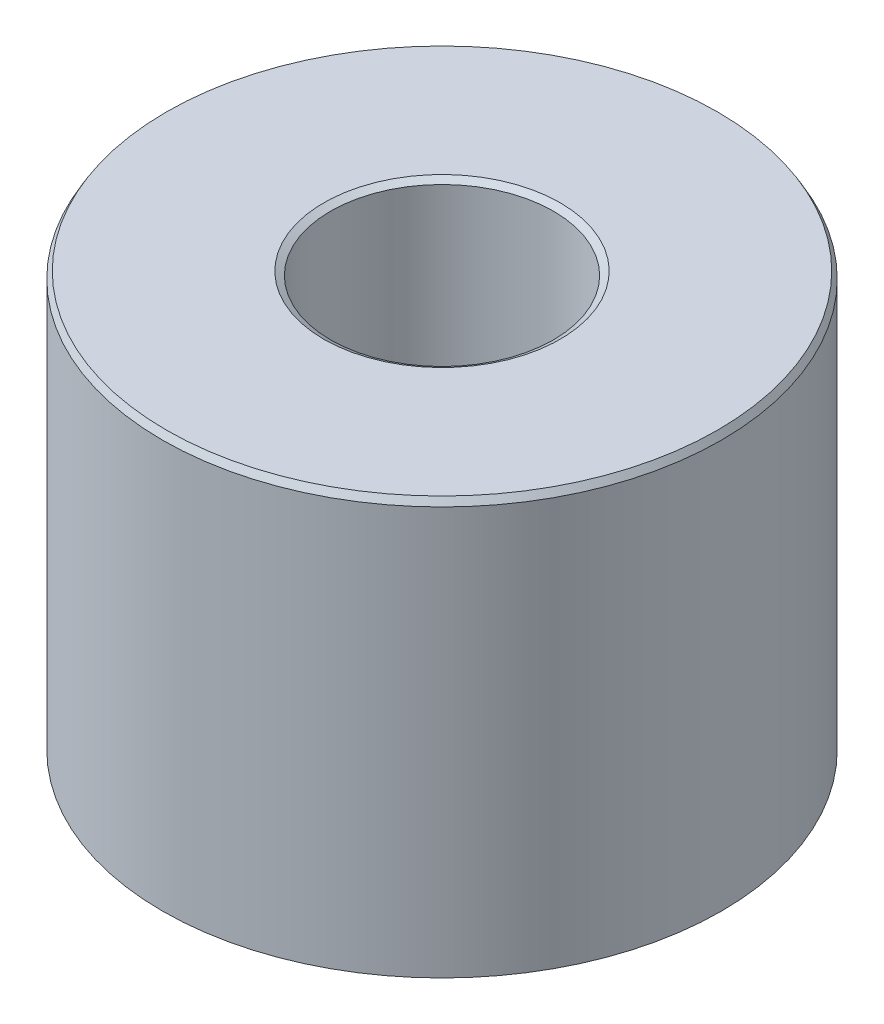
from build123d import *
from OCP.BRepFilletAPI import BRepFilletAPI_MakeChamfer

# Parameters (mm, degrees)
SKETCH1_R           = 25
BOSS_EXTRUDE1_DEPTH = 37.439071314
SKETCH2_R           = 9.972717925
CUT_EXTRUDE1_DEPTH  = 52.494505152
CHAMFER1_SIZE       = 0.602399946
CHAMFER1_SIZE2      = 0.347795771


with BuildPart() as part:
    # Sketch1 → Boss-Extrude1 (new body)
    with BuildSketch(Plane(origin=(0, 0, 0), x_dir=(1, 0, 0), z_dir=(0, 1, 0))):
        Circle(SKETCH1_R)
    extrude(amount=BOSS_EXTRUDE1_DEPTH)

    # Sketch2 → Cut-Extrude1 (cut, through all)
    with BuildSketch(Plane(origin=(0, 0, 0), x_dir=(1, 0, 0), z_dir=(0, 1, 0))):
        Circle(SKETCH2_R)
    extrude(amount=CUT_EXTRUDE1_DEPTH, mode=Mode.SUBTRACT)

    # Chamfer1: one chamfer whose edges measure the first distance from different faces: ONE call of the kernel's chamfer builder (chamfer() names one face for all edges)
    chamfer1_edges_1 = [part.edges().sort_by_distance(p)[0] for p in [
        (-9.972717925, 37.439071314, 0),
    ]]
    chamfer1_side_1 = [part.faces().sort_by_distance(p)[0] for p in [
        (-24.292893219, 37.439071314, 0),
    ]]
    chamfer1_edges_2 = [part.edges().sort_by_distance(p)[0] for p in [
        (-9.972717925, 0, 0),
    ]]
    chamfer1_side_2 = [part.faces().sort_by_distance(p)[0] for p in [
        (-9.972717925, 18.719535657, 0),
    ]]
    chamfer1_edges_3 = [part.edges().sort_by_distance(p)[0] for p in [
        (-25, 0, 0),
    ]]
    chamfer1_side_3 = [part.faces().sort_by_distance(p)[0] for p in [
        (-24.292893219, 0, 0),
    ]]
    chamfer1_edges_4 = [part.edges().sort_by_distance(p)[0] for p in [
        (-25, 37.439071314, 0),
    ]]
    chamfer1_side_4 = [part.faces().sort_by_distance(p)[0] for p in [
        (-25, 18.719535657, 0),
    ]]
    chamfer1 = BRepFilletAPI_MakeChamfer(part.part.solid().wrapped)
    for e in chamfer1_edges_1:
        chamfer1.Add(CHAMFER1_SIZE, CHAMFER1_SIZE2, e.wrapped, chamfer1_side_1[0].wrapped)  # the first distance lies on this face
    for e in chamfer1_edges_2:
        chamfer1.Add(CHAMFER1_SIZE, CHAMFER1_SIZE2, e.wrapped, chamfer1_side_2[0].wrapped)  # the first distance lies on this face
    for e in chamfer1_edges_3:
        chamfer1.Add(CHAMFER1_SIZE, CHAMFER1_SIZE2, e.wrapped, chamfer1_side_3[0].wrapped)  # the first distance lies on this face
    for e in chamfer1_edges_4:
        chamfer1.Add(CHAMFER1_SIZE, CHAMFER1_SIZE2, e.wrapped, chamfer1_side_4[0].wrapped)  # the first distance lies on this face
    add(Compound.cast(chamfer1.Shape()), mode=Mode.REPLACE)


solid = part.part
